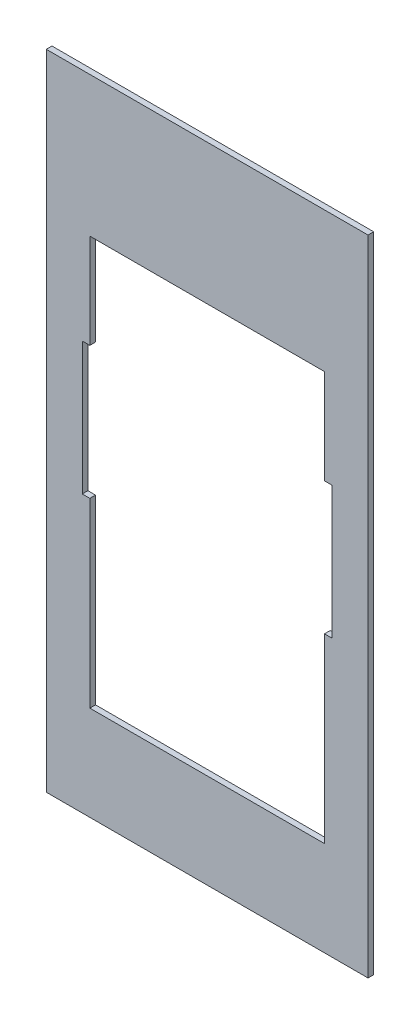
from build123d import *

# Parameters (mm, degrees)
SKETCH1_W           = 85
SKETCH1_H           = 170
BOSS_EXTRUDE1_DEPTH = 1.5


with BuildPart() as part:
    # Sketch1 → Boss-Extrude1 (new body)
    with BuildSketch(Plane.XY):
        Rectangle(SKETCH1_W, SKETCH1_H)
        Polygon((-31, -12), (-31, -60), (31, -60), (31, -12), (33, -12), (33, 23), (31, 23), (31, 48), (-31, 48), (-31, 23), (-33, 23), (-33, -12), align=None, mode=Mode.SUBTRACT)
    extrude(amount=BOSS_EXTRUDE1_DEPTH)


solid = part.part
